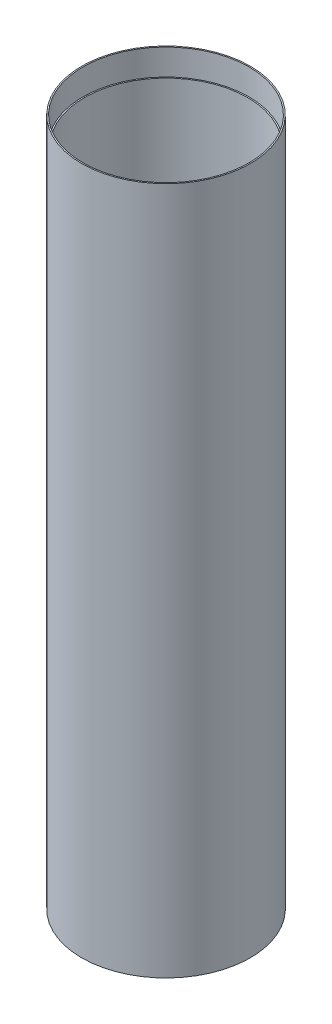
from build123d import *


with BuildPart() as part:
    # Szkic1 → Obrót1 (revolve)
    with BuildSketch(Plane.XY):
        Polygon((64, 265), (65, 265), (65, -265), (64, -265), (64, -245), (63, -245), (63, 245), (64, 245), align=None)
    revolve(axis=Axis((0, 0, 0), (0, 1, 0)))


solid = part.part
